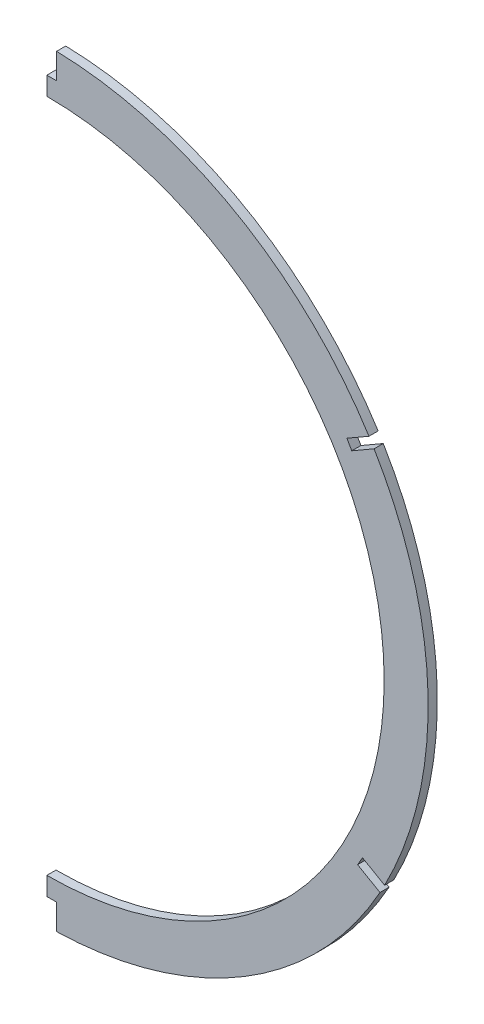
from build123d import *

# Parameters (mm, degrees)
SKETCH2_R           = 116.84
BOSS_EXTRUDE1_DEPTH = 1.5875
SKETCH3_W           = 232.210592103
SKETCH3_H           = 398.954583541
CUT_EXTRUDE1_DEPTH  = 190.3271535
CUT_EXTRUDE2_DEPTH  = 190.347119125


with BuildPart() as part:
    # Sketch2 → Boss-Extrude1 (new, symmetric)
    with BuildSketch(Plane.XY):
        with BuildLine():
            ThreePointArc((-1.651, 128.513680847), (-113.443755652, 64.087482344), (-116.974071472, -64.89271823))
            ThreePointArc((-116.974071472, -64.89271823), (-116.588202689, -65.623039511), (-116.197774242, -66.350933404))
            ThreePointArc((-116.197774242, -66.350933404), (-115.802941233, -67.076116512), (-115.403582459, -67.798817153))
            ThreePointArc((-115.403582459, -67.798817153), (0, -135.636), (115.403582459, -67.798817153))
            ThreePointArc((115.403582459, -67.798817153), (115.802941375, -67.076116254), (116.197774523, -66.350932884))
            ThreePointArc((116.197774523, -66.350932884), (116.588202828, -65.62303925), (116.974071472, -64.89271823))
            ThreePointArc((116.974071472, -64.89271823), (113.443755652, 64.087482344), (1.651, 128.513680847))
            ThreePointArc((1.651, 128.513680847), (0.825516124, 128.521420187), (0, 128.524))
            ThreePointArc((0, 128.524), (-0.825516124, 128.521420187), (-1.651, 128.513680847))
        make_face()
        with Locations((0, -3.556)):
            Circle(SKETCH2_R, mode=Mode.SUBTRACT)
    extrude(amount=BOSS_EXTRUDE1_DEPTH, both=True)

    # Sketch3 → Cut-Extrude1 (cut, through all)
    with BuildSketch(Plane(origin=(0, 0, 0), x_dir=(0, 0, -1), z_dir=(1, 0, 0))):
        with Locations((6.714523145, -6.913261573)):
            Rectangle(SKETCH3_W, SKETCH3_H)
    extrude(amount=-CUT_EXTRUDE1_DEPTH, mode=Mode.SUBTRACT)

    # Sketch4 → Cut-Extrude2 (cut, through all)
    with BuildSketch(Plane.XY.offset(1.5875)):
        with BuildLine():
            ThreePointArc((0, -135.636), (1.689238161, -135.625197296), (3.3782, -135.592790951))
            Line((3.3782, -135.592790951), (3.3782, -126.746))
            Line((3.3782, -126.746), (0, -126.746))
            Line((0, -126.746), (0, -135.636))
        make_face()
        with BuildLine():
            ThreePointArc((115.385044136, -67.832107456), (116.197919214, -66.350665143), (116.99177489, -64.858944531))
            Line((116.99177489, -64.858944531), (109.337447053, -60.439716293))
            Line((109.337447053, -60.439716293), (107.648347053, -63.365323312))
            Line((107.648347053, -63.365323312), (115.385044136, -67.832107456))
        make_face()
        with BuildLine():
            ThreePointArc((113.357263981, 64.23232571), (112.480734843, 65.677017334), (111.585794735, 67.110376823))
            Line((111.585794735, 67.110376823), (103.931466898, 62.691148586))
            Line((103.931466898, 62.691148586), (105.620566898, 59.765541567))
            Line((105.620566898, 59.765541567), (113.357263981, 64.23232571))
        make_face()
        with BuildLine():
            Line((0, 119.634), (3.3782, 119.634))
            Line((3.3782, 119.634), (3.3782, 128.480790951))
            ThreePointArc((3.3782, 128.480790951), (1.689238161, 128.513197296), (0, 128.524))
            Line((0, 128.524), (0, 119.634))
        make_face()
    extrude(amount=-CUT_EXTRUDE2_DEPTH, mode=Mode.SUBTRACT)


solid = part.part
